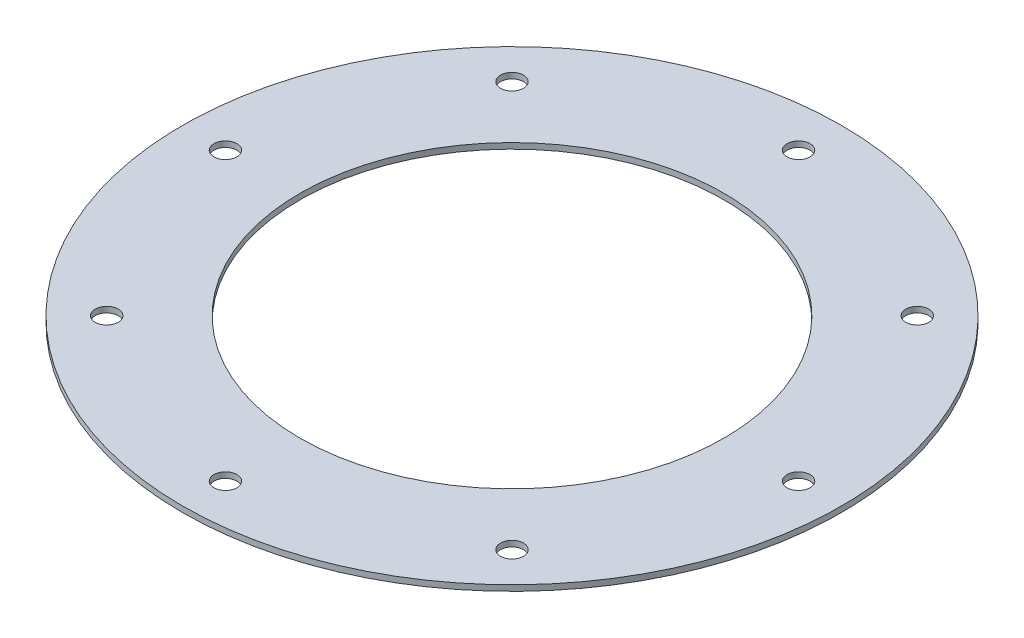
from build123d import *

# Parameters (mm, degrees)
SKETCH1_R           = 115
SKETCH1_R_2         = 74
SKETCH1_R_3         = 4
BOSS_EXTRUDE1_DEPTH = 2


with BuildPart() as part:
    # Sketch1 → Boss-Extrude1 (new body)
    with BuildSketch(Plane(origin=(0, 0, 0), x_dir=(1, 0, 0), z_dir=(0, 1, 0))):
        Circle(SKETCH1_R)
        Circle(SKETCH1_R_2, mode=Mode.SUBTRACT)
        with Locations((-100, 0)):
            Circle(SKETCH1_R_3, mode=Mode.SUBTRACT)
        with Locations((-70.710678119, 70.710678119)):
            Circle(SKETCH1_R_3, mode=Mode.SUBTRACT)
        with Locations((0, 100)):
            Circle(SKETCH1_R_3, mode=Mode.SUBTRACT)
        with Locations((70.710678119, 70.710678119)):
            Circle(SKETCH1_R_3, mode=Mode.SUBTRACT)
        with Locations((100, 0)):
            Circle(SKETCH1_R_3, mode=Mode.SUBTRACT)
        with Locations((70.710678119, -70.710678119)):
            Circle(SKETCH1_R_3, mode=Mode.SUBTRACT)
        with Locations((0, -100)):
            Circle(SKETCH1_R_3, mode=Mode.SUBTRACT)
        with Locations((-70.710678119, -70.710678119)):
            Circle(SKETCH1_R_3, mode=Mode.SUBTRACT)
    extrude(amount=BOSS_EXTRUDE1_DEPTH)


solid = part.part
